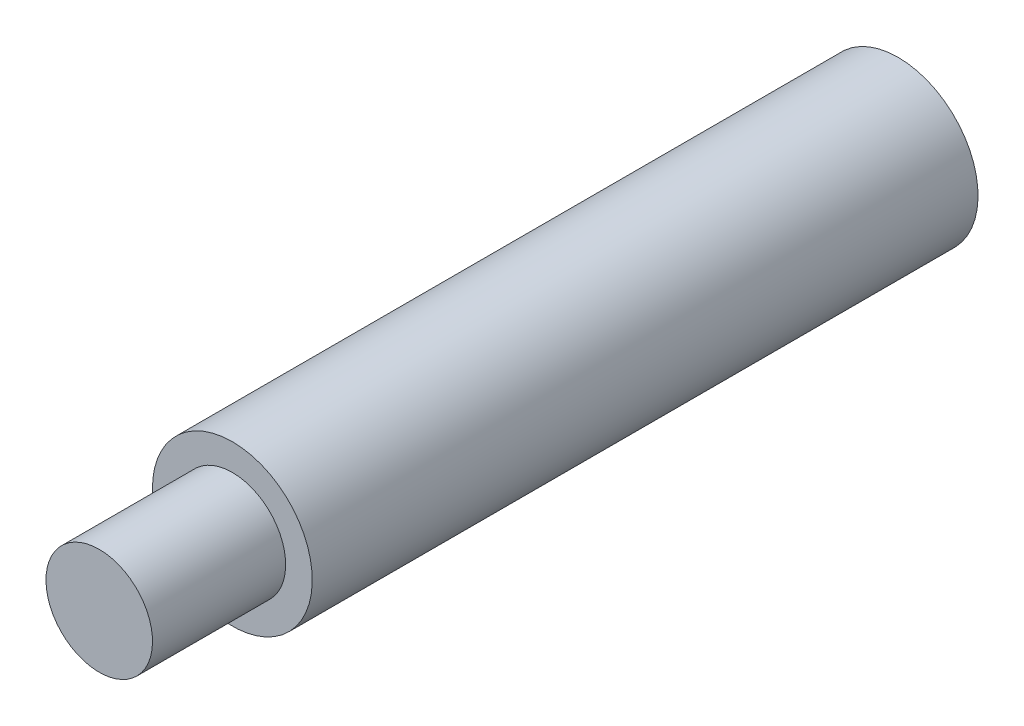
from build123d import *


with BuildPart() as part:
    # Sketch1 → Revolve1 (revolve)
    with BuildSketch(Plane(origin=(0, 0, 0), x_dir=(0, 0, -1), z_dir=(1, 0, 0))):
        Polygon((-10, 0), (-10, 4), (0, 4), (0, 6), (50, 6), (50, 4), (40, 4), (40, 0), align=None)
    revolve(axis=Axis((0, 0, -40), (0, 0, 1)))


solid = part.part
